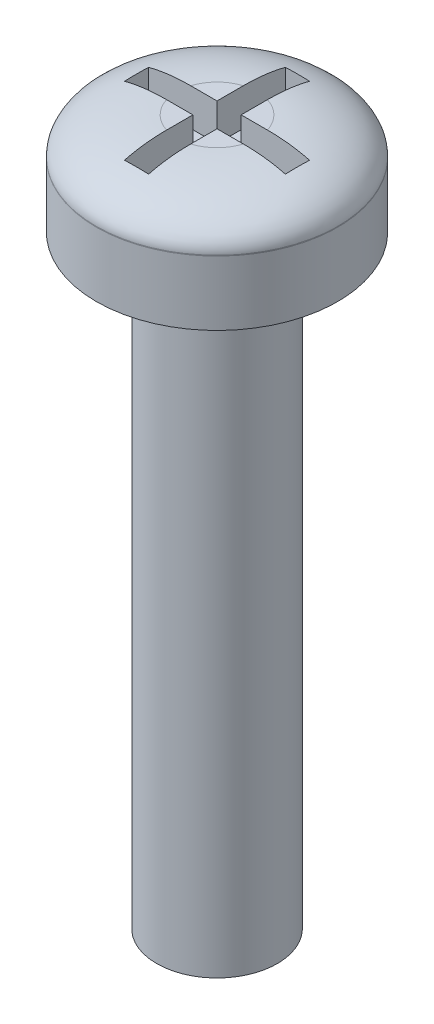
from build123d import *

# Parameters (mm, degrees)
SKICA1_R                 = 1.5
P_IDAT_VYSUNUT_M1_DEPTH  = 15
SKICA2_R                 = 3
P_IDAT_VYSUNUT_M2_DEPTH  = 1.6
SKICA3_R                 = 2.999911278
P_IDAT_VYSUNUT_M3_DEPTH  = 0.92
ZAOBLIT1_SIZE            = 0.9
ZAOBLIT1_SIZE_2          = 2
SKICA4_W                 = 0.6
SKICA4_H                 = 4
SKICA4_W_2               = 4
SKICA4_H_2               = 0.6
ODEBRAT_VYSUNUT_M1_DEPTH = 0.92


with BuildPart() as part:
    # Skica1 → Přidat vysunutím1 (new body)
    with BuildSketch(Plane(origin=(0, 0, 0), x_dir=(1, 0, 0), z_dir=(0, 1, 0))):
        with Locations(Location((0, 0, 0), (0, 0, 270))):
            Circle(SKICA1_R)
    extrude(amount=P_IDAT_VYSUNUT_M1_DEPTH)

    # Skica2 → Přidat vysunutím2 (add)
    with BuildSketch(Plane(origin=(0, 15, 0), x_dir=(1, 0, 0), z_dir=(0, 1, 0))):
        with Locations(Location((0, 0, 0), (0, 0, 270))):
            Circle(SKICA2_R)
    extrude(amount=P_IDAT_VYSUNUT_M2_DEPTH)

    # Skica3 → Přidat vysunutím3 (add)
    with BuildSketch(Plane(origin=(0, 16.6, 0), x_dir=(1, 0, 0), z_dir=(0, 1, 0))):
        with Locations(Location((0, 0, 0), (0, 0, 270))):
            Circle(SKICA3_R)
    extrude(amount=P_IDAT_VYSUNUT_M3_DEPTH)

    # Zaoblit1
    # an asymmetric fillet: 2, 0.9 mm, written as the material it takes off along each edge
    with BuildSketch(Plane(origin=(0, 17.52, 0), x_dir=(0, 0, 1), z_dir=(-1, 0, 0))) as zaoblit1_piece_1:
        with BuildLine():
            Bezier((2.999911278, -ZAOBLIT1_SIZE), (2.999911278, 0), (2.999911278 - ZAOBLIT1_SIZE_2, 0), weights=[1, 0.707106781, 1])
            Line((2.999911278 - ZAOBLIT1_SIZE_2, 0), (2.999911278, 0))
            Line((2.999911278, 0), (2.999911278, -ZAOBLIT1_SIZE))
        make_face()
    revolve(axis=Axis((0, 17.52, 0), (0, 1, 0)), mode=Mode.SUBTRACT)

    # Skica4 → Odebrat vysunutím1 (cut)
    with BuildSketch(Plane(origin=(0, 17.52, 0), x_dir=(1, 0, 0), z_dir=(0, 1, 0))):
        Rectangle(SKICA4_W, SKICA4_H)
        Rectangle(SKICA4_W_2, SKICA4_H_2)
    extrude(amount=-ODEBRAT_VYSUNUT_M1_DEPTH, mode=Mode.SUBTRACT)


solid = part.part
